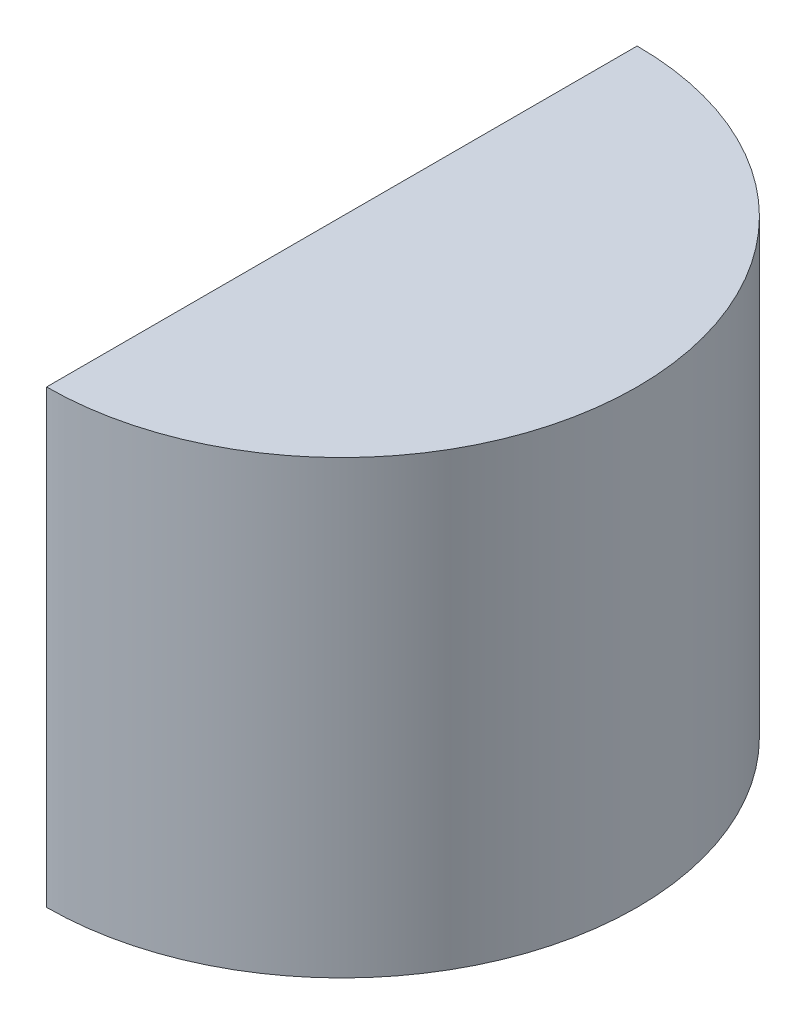
from build123d import *

# Parameters (mm, degrees)
SKETCH1_R                = 19
BOSS_EXTRUDE1_DEPTH      = 29
SPLIT1_SURFACE_1_BACK    = 62.066
SPLIT1_SURFACE_1_DEPTH   = 124.132
SPLIT1_SURFACE_2_BACK    = 62.066
SPLIT1_SURFACE_2_DEPTH   = 124.132
BODY_DELETE_KEEP_1_DEPTH = 29


# Read off the part's stored shape, not the designer's step: Body-Delete/Keep 1
with BuildPart() as part:
    # Sketch1 → Boss-Extrude1 (new body)
    with BuildSketch(Plane(origin=(0, 0, 0), x_dir=(1, 0, 0), z_dir=(0, 1, 0))):
        with Locations(Location((0, 0, 0), (0, 0, 270))):
            Circle(SKETCH1_R)
    extrude(amount=BOSS_EXTRUDE1_DEPTH)


with BuildPart() as body_2:
    # Split1: the piece behind the surface
    add(part.part)
    # Split1 surface: a surface, the sketch's curves swept straight by 124.132 mm
    with BuildLine(Plane.XY.offset(-SPLIT1_SURFACE_1_BACK), mode=Mode.PRIVATE) as split1_surface_1_path:
        Line((0, 30.065054412), (0, -0.518911578))
    split1_surface_1 = Shell.extrude(split1_surface_1_path.wire(), (0 * SPLIT1_SURFACE_1_DEPTH, 0 * SPLIT1_SURFACE_1_DEPTH, 1 * SPLIT1_SURFACE_1_DEPTH))
    split(bisect_by=split1_surface_1, keep=Keep.BOTTOM)

    # Body-Delete/Keep 1 outline → Body-Delete/Keep 1 (cut)
    with BuildSketch(Plane(origin=(0, 0, 0), x_dir=(1, 0, 0), z_dir=(0, 1, 0))):
        with BuildLine():
            ThreePointArc((0, 19), (-19, 0), (0, -19))
            Line((0, -19), (0, 19))
        make_face()
    extrude(amount=BODY_DELETE_KEEP_1_DEPTH, mode=Mode.SUBTRACT)


with BuildPart() as part_1:
    add(part.part)

    # Split1: split by a surface, the side it looks to stays
    # Split1 surface: a surface, the sketch's curves swept straight by 124.132 mm
    with BuildLine(Plane.XY.offset(-SPLIT1_SURFACE_2_BACK), mode=Mode.PRIVATE) as split1_surface_2_path:
        Line((0, 30.065054412), (0, -0.518911578))
    split1_surface_2 = Shell.extrude(split1_surface_2_path.wire(), (0 * SPLIT1_SURFACE_2_DEPTH, 0 * SPLIT1_SURFACE_2_DEPTH, 1 * SPLIT1_SURFACE_2_DEPTH))
    split(bisect_by=split1_surface_2, keep=Keep.TOP)


solid = part_1.part
